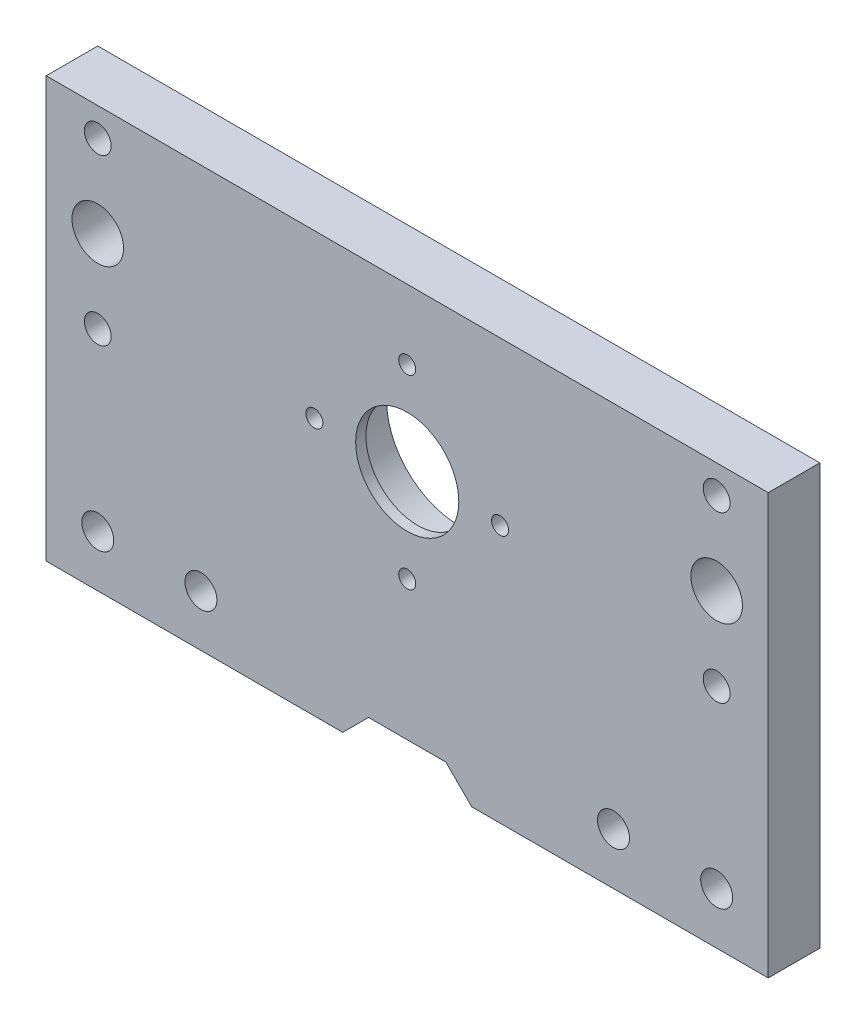
from build123d import *

# Parameters (mm, degrees)
SKETCH1_W           = 140
SKETCH1_H           = 81.5
BOSS_EXTRUDE1_DEPTH = 10
SKETCH2_R           = 14
CUT_EXTRUDE2_DEPTH  = 8
SKETCH5_R           = 5
SKETCH5_R_2         = 2.6
SKETCH5_R_3         = 3.1
CUT_EXTRUDE4_DEPTH  = 82.612269298
SKETCH25_W          = 35
SKETCH25_H          = 5
CUT_EXTRUDE6_DEPTH  = 82.612269298
CHAMFER2_SIZE       = 10
SKETCH27_R          = 10
CUT_EXTRUDE8_DEPTH  = 3
CIRPATTERN1_COUNT   = 4


with BuildPart() as part:
    # Sketch1 → Boss-Extrude1 (new body)
    with BuildSketch(Plane.XY):
        Rectangle(SKETCH1_W, SKETCH1_H)
    extrude(amount=BOSS_EXTRUDE1_DEPTH)

    # Sketch2 → Cut-Extrude2 (cut)
    with BuildSketch(Plane(origin=(0, 0, 0), x_dir=(-1, 0, 0), z_dir=(0, 0, -1))):
        with Locations((0, 9.25)):
            Circle(SKETCH2_R)
    extrude(amount=-CUT_EXTRUDE2_DEPTH, mode=Mode.SUBTRACT)

    # Sketch5 → Cut-Extrude4 (cut, through all)
    with BuildSketch(Plane(origin=(0, 0, 0), x_dir=(-1, 0, 0), z_dir=(0, 0, -1))):
        with Locations((-60, 19.25)):
            Circle(SKETCH5_R)
        with Locations((60, 19.25)):
            Circle(SKETCH5_R)
        with Locations((-60, 35.25)):
            Circle(SKETCH5_R_2)
        with Locations((-60, 3.25)):
            Circle(SKETCH5_R_2)
        with Locations((60, 35.25)):
            Circle(SKETCH5_R_2)
        with Locations((60, 3.25)):
            Circle(SKETCH5_R_2)
        with Locations((-60, -30.75)):
            Circle(SKETCH5_R_3)
        with Locations((-40, -30.75)):
            Circle(SKETCH5_R_3)
        with Locations((40, -30.75)):
            Circle(SKETCH5_R_3)
        with Locations((60, -30.75)):
            Circle(SKETCH5_R_3)
    extrude(amount=-CUT_EXTRUDE4_DEPTH, mode=Mode.SUBTRACT)

    # Sketch25 → Cut-Extrude6 (cut, through all)
    with BuildSketch(Plane.XY.offset(10)):
        with Locations((0, -38.25)):
            Rectangle(SKETCH25_W, SKETCH25_H)
    extrude(amount=-CUT_EXTRUDE6_DEPTH, mode=Mode.SUBTRACT)

    # Chamfer2
    # the kernel refuses this chamfer: 10 mm, written as the material it adds along each edge
    with BuildSketch(Plane(origin=(17.5, -35.75, 10), x_dir=(-0.9996219169112968, 0.027495876610586317, 0), z_dir=(0, 0, -1))) as chamfer2_piece_1_section:
        Polygon((CHAMFER2_SIZE * 0.999621916911, -CHAMFER2_SIZE * 0.0274958766106), (-CHAMFER2_SIZE * 0.0274958766106, -CHAMFER2_SIZE * 0.999621916911), (0, 0), align=None)
    chamfer2_piece_1 = extrude(amount=10, mode=Mode.PRIVATE)
    chamfer2_piece_1 = split(chamfer2_piece_1, bisect_by=Plane(origin=(13.565989159, -40.75, 5), z_dir=(0, 1, 0)), keep=Keep.TOP, mode=Mode.PRIVATE)
    add(chamfer2_piece_1)
    with BuildSketch(Plane(origin=(-17.5, -35.75, 10), x_dir=(-0.027495876610586317, -0.9996219169112968, 0), z_dir=(0, 0, -1))) as chamfer2_piece_2_section:
        Polygon((CHAMFER2_SIZE * 0.999621916911, -CHAMFER2_SIZE * 0.0274958766106), (-CHAMFER2_SIZE * 0.0274958766106, -CHAMFER2_SIZE * 0.999621916911), (0, 0), align=None)
    chamfer2_piece_2 = extrude(amount=10, mode=Mode.PRIVATE)
    chamfer2_piece_2 = split(chamfer2_piece_2, bisect_by=Plane(origin=(-13.565989159, -40.75, 5), z_dir=(0, 1, 0)), keep=Keep.TOP, mode=Mode.PRIVATE)
    add(chamfer2_piece_2)

    # Sketch27 → Cut-Extrude8 (cut)
    with BuildSketch(Plane(origin=(0, 0, 8), x_dir=(-1, 0, 0), z_dir=(0, 0, -1))):
        with Locations((0, 9.25)):
            Circle(SKETCH27_R)
    extrude(amount=-CUT_EXTRUDE8_DEPTH, mode=Mode.SUBTRACT)

    # Sketch30 → M4 Tapped Hole1 (revolve, cut)
    with BuildSketch(Plane(origin=(0, 27.25, 0), x_dir=(0, 1, 0), z_dir=(1, 0, 0))):
        Polygon((0, 0), (0, 11.091420021), (1.65, 10.1), (1.65, 0), align=None)
    m4_tapped_hole1 = revolve(axis=Axis((0, 27.25, -6.35), (0, 0, 1)), mode=Mode.SUBTRACT)

    # CirPattern1: M4 Tapped Hole1 ×4 about axis
    cirpattern1_axis = Axis((0, 9.25, 0), (0, 0, 1))
    for i in range(1, CIRPATTERN1_COUNT):
        add(m4_tapped_hole1.rotate(cirpattern1_axis, i * 360 / CIRPATTERN1_COUNT), mode=Mode.SUBTRACT)


solid = part.part
